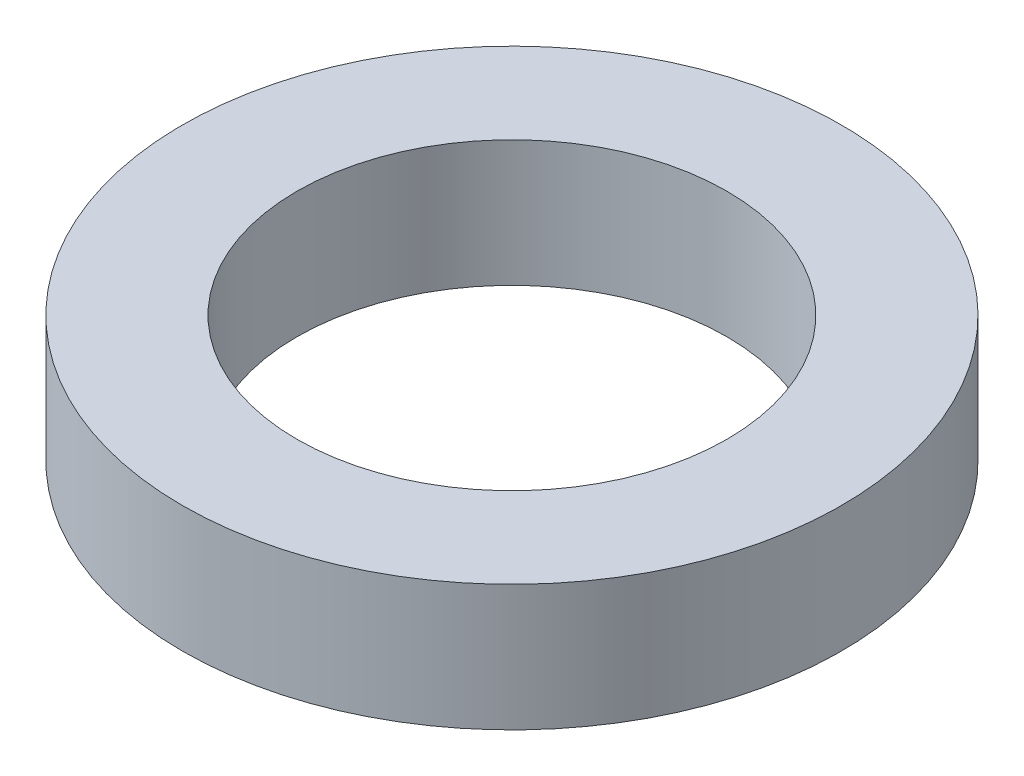
from build123d import *

# Parameters (mm, degrees)
SKETCH1_R           = 57.5
BOSS_EXTRUDE1_DEPTH = 22
SKETCH2_R           = 37.5
CUT_EXTRUDE1_DEPTH  = 85.240726493


with BuildPart() as part:
    # Sketch1 → Boss-Extrude1 (new body)
    with BuildSketch(Plane(origin=(0, 0, 0), x_dir=(1, 0, 0), z_dir=(0, 1, 0))):
        Circle(SKETCH1_R)
    extrude(amount=BOSS_EXTRUDE1_DEPTH)

    # Sketch2 → Cut-Extrude1 (cut, through all)
    with BuildSketch(Plane(origin=(0, 0, 0), x_dir=(1, 0, 0), z_dir=(0, 1, 0))):
        Circle(SKETCH2_R)
    extrude(amount=CUT_EXTRUDE1_DEPTH, mode=Mode.SUBTRACT)


solid = part.part
